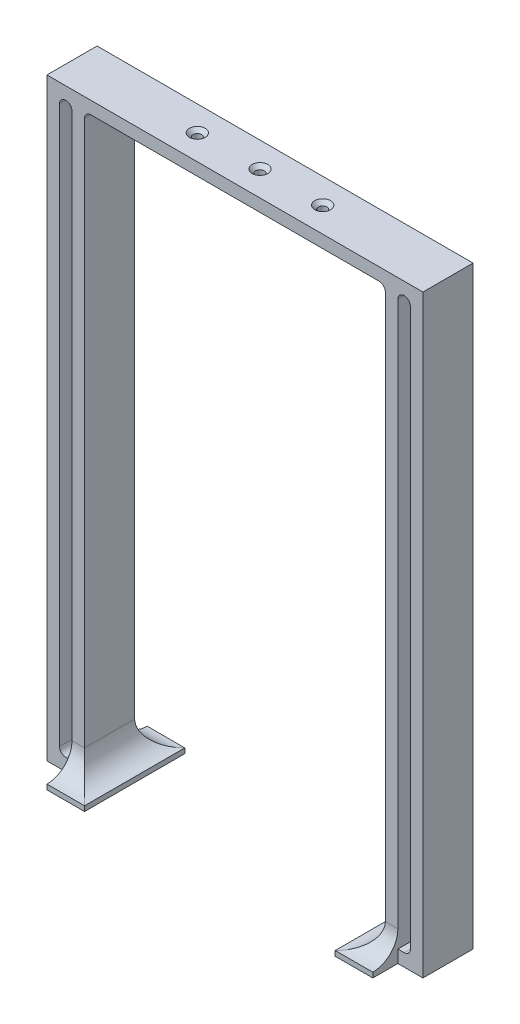
from build123d import *

# Parameters (mm, degrees)
SKETCH2_W                                       = 5
SKETCH2_H                                       = 227
BOSS_EXTRUDE1_DEPTH                             = 20
BOSS_EXTRUDE2_REACH                             = 277.987
CUT_EXTRUDE1_DEPTH                              = 44
F_3_0MM_DOWEL_HOLE1_D                           = 3
F_3_0MM_DOWEL_HOLE1_DEPTH                       = 3
F_3_0MM_DOWEL_HOLE1_TIP                         = 0.901290929
CSK_FOR_M3_FLAT_HEAD_MACHINE_SCREW1_D           = 3.4
CSK_FOR_M3_FLAT_HEAD_MACHINE_SCREW1_CSINK_D     = 6.3
CSK_FOR_M3_FLAT_HEAD_MACHINE_SCREW1_CSINK_ANGLE = 90
FILLET1_R                                       = 2.5


with BuildPart() as part:
    # Sketch2 → Boss-Extrude1 (new body)
    with BuildSketch(Plane.XY):
        Polygon((15, 12), (5, 12), (5, 232), (125, 232), (125, 12), (115, 12), (115, 0), (140, 0), (140, 237), (-10, 237), (-10, 0), (15, 0), align=None)
        with Locations((132.5, 118.5)):
            Rectangle(SKETCH2_W, SKETCH2_H, mode=Mode.SUBTRACT)
        with Locations((-2.5, 118.5)):
            Rectangle(SKETCH2_W, SKETCH2_H, mode=Mode.SUBTRACT)
    extrude(amount=BOSS_EXTRUDE1_DEPTH)

    # Boss-Extrude2: up to this face of the body (flat: up to its plane)
    boss_extrude2_end = Plane(part.part.faces().sort_by_distance((130, 118.5, 10))[0])
    # Sketch3 → Boss-Extrude2 (add, up to the picked face)
    with BuildSketch(Plane.ZY, mode=Mode.PRIVATE) as boss_extrude2_sk1:
        with BuildLine():
            Line((20, 0), (30, 0))
            Line((30, 0), (30, 2))
            ThreePointArc((30, 2), (22.928932188, 4.928932188), (20, 12))
            Line((20, 12), (20, 0))
        make_face()
    boss_extrude2_tool1 = split(extrude(boss_extrude2_sk1.sketch, amount=-BOSS_EXTRUDE2_REACH, mode=Mode.PRIVATE), bisect_by=boss_extrude2_end, keep=Keep.BOTH, mode=Mode.PRIVATE)
    # Sketch3 → Boss-Extrude2 (add, up to the picked face)
    with BuildSketch(Plane.ZY, mode=Mode.PRIVATE) as boss_extrude2_sk2:
        with BuildLine():
            Line((0, 0), (-10, 0))
            Line((-10, 0), (-10, 2))
            ThreePointArc((-10, 2), (-2.928932188, 4.928932188), (0, 12))
            Line((0, 12), (0, 0))
        make_face()
    boss_extrude2_tool2 = split(extrude(boss_extrude2_sk2.sketch, amount=-BOSS_EXTRUDE2_REACH, mode=Mode.PRIVATE), bisect_by=boss_extrude2_end, keep=Keep.BOTH, mode=Mode.PRIVATE)
    add(boss_extrude2_tool1.solids().sort_by(Axis((0, 2.673783, 23.568126), (1, 0, 0)))[0])
    add(boss_extrude2_tool2.solids().sort_by(Axis((0, 2.673783, -3.568126), (1, 0, 0)))[0])

    # Sketch4 → Cut-Extrude1 (cut)
    with BuildSketch(Plane.XY.offset(30)):
        with BuildLine():
            Line((15, 2), (15, 0))
            Line((15, 0), (115, 0))
            Line((115, 0), (115, 2))
            ThreePointArc((115, 2), (122.071067812, 4.928932188), (125, 12))
            Line((125, 12), (5, 12))
            ThreePointArc((5, 12), (7.928932188, 4.928932188), (15, 2))
        make_face()
    extrude(amount=-CUT_EXTRUDE1_DEPTH, mode=Mode.SUBTRACT)

    # Ø3.0mm Dowel Hole1
    with Locations(Plane.XZ):
        with Locations((7.5, 10), (122.5, 10)):
            Hole(F_3_0MM_DOWEL_HOLE1_D / 2, depth=F_3_0MM_DOWEL_HOLE1_DEPTH)
            with Locations((0, 0, -(F_3_0MM_DOWEL_HOLE1_DEPTH + F_3_0MM_DOWEL_HOLE1_TIP / 2))):  # 118° drill point
                Cone(0, F_3_0MM_DOWEL_HOLE1_D / 2, F_3_0MM_DOWEL_HOLE1_TIP, mode=Mode.SUBTRACT)

    # CSK for M3 Flat Head Machine Screw1 (through all)
    with Locations(Plane(origin=(0, 237, 0), x_dir=(1, 0, 0), z_dir=(0, 1, 0))):
        with Locations((40, -10), (90, -10), (65, -10)):
            CounterSinkHole(CSK_FOR_M3_FLAT_HEAD_MACHINE_SCREW1_D / 2, CSK_FOR_M3_FLAT_HEAD_MACHINE_SCREW1_CSINK_D / 2, counter_sink_angle=CSK_FOR_M3_FLAT_HEAD_MACHINE_SCREW1_CSINK_ANGLE)

    # Fillet1
    fillet1_edges = [part.edges().sort_by_distance(p)[0] for p in [
        (0, 232, 10),
        (-5, 232, 10),
        (-5, 5, 10),
        (130, 232, 10),
        (135, 232, 10),
        (135, 5, 10),
        (5, 232, 10),
        (125, 232, 10),
    ]]
    fillet(fillet1_edges, radius=FILLET1_R - 0.0001)  # a hair under: the kernel refuses the full size


solid = part.part
